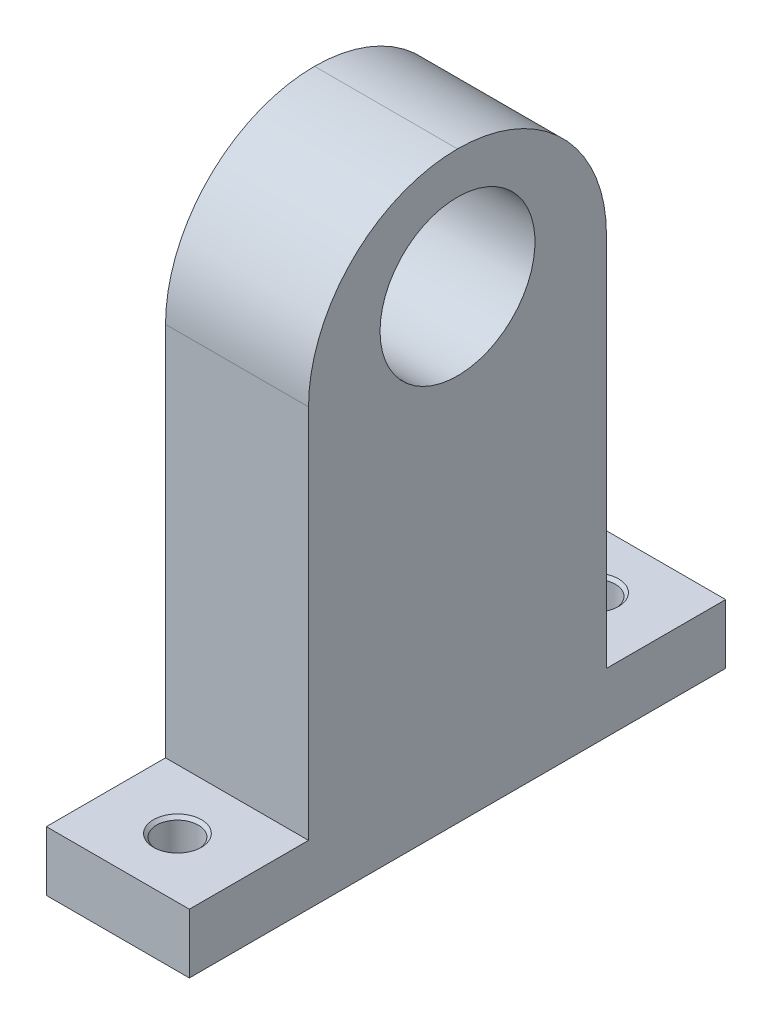
from build123d import *

# Parameters (mm, degrees)
EXTRUDE_1_DEPTH      = 10
EXTRUDE_2_DEPTH      = 68
SKETCH_9_W           = 24
SKETCH_9_H           = 50
EXTRUDE_4_DEPTH      = 20
SKETCH_10_R          = 13
CUT_EXTRUDE_3_DEPTH  = 109.53570841
FILLET_6_R           = 25
SKETCH_22_W          = 24
SKETCH_22_H          = 5
EXTRUDE_5_DEPTH      = 10
M8X1_0_1_D           = 7
M8X1_0_1_CSINK_D     = 8.05
M8X1_0_1_CSINK_ANGLE = 90


with BuildPart() as part:
    # 草图1 → 凸台-拉伸1 (new body)
    with BuildSketch(Plane(origin=(0, 0, 0), x_dir=(1, 0, 0), z_dir=(0, 1, 0))):
        Polygon((12, 37.5), (12, 40), (-12, 40), (-12, 37.5), (-12, -37.5), (-12, -40), (12, -40), (12, -37.5), align=None)
    extrude(amount=EXTRUDE_1_DEPTH)

    # 草图2 → 凸台-拉伸2 (add)
    with BuildSketch(Plane(origin=(0, 10, 0), x_dir=(1, 0, 0), z_dir=(0, 1, 0))):
        Polygon((-4, 25), (-12, 25), (-12, -25), (-4, -25), (4, -25), (12, -25), (12, 25), (4, 25), align=None)
    extrude(amount=EXTRUDE_2_DEPTH)

    # 草图9 → 凸台-拉伸4 (add)
    with BuildSketch(Plane(origin=(0, 78, 0), x_dir=(1, 0, 0), z_dir=(0, 1, 0))):
        Rectangle(SKETCH_9_W, SKETCH_9_H)
    extrude(amount=EXTRUDE_4_DEPTH)

    # 草图10 → 切除-拉伸3 (cut, through all)
    with BuildSketch(Plane.ZY.offset(12)):
        with Locations((0, 78)):
            Circle(SKETCH_10_R)
    extrude(amount=-CUT_EXTRUDE_3_DEPTH, mode=Mode.SUBTRACT)

    # 圆角6
    fillet_6_edges = [part.edges().sort_by_distance(p)[0] for p in [
        (0, 98, -25),
        (0, 98, 25),
    ]]
    fillet(fillet_6_edges, radius=FILLET_6_R - 0.0001)  # a hair under: the kernel refuses the full size

    # 草图22 → 凸台-拉伸5 (add)
    with BuildSketch(Plane.XZ):
        with Locations((0, 42.5)):
            Rectangle(SKETCH_22_W, SKETCH_22_H)
        with Locations((0, -42.5)):
            Rectangle(SKETCH_22_W, SKETCH_22_H)
    extrude(amount=-EXTRUDE_5_DEPTH)

    # M8x1.0 螺纹孔1 (through all)
    with Locations(Plane(origin=(0, 10, 0), x_dir=(1, 0, 0), z_dir=(0, 1, 0))):
        with Locations((0, -35), (0, 35)):
            CounterSinkHole(M8X1_0_1_D / 2, M8X1_0_1_CSINK_D / 2, counter_sink_angle=M8X1_0_1_CSINK_ANGLE)


solid = part.part
